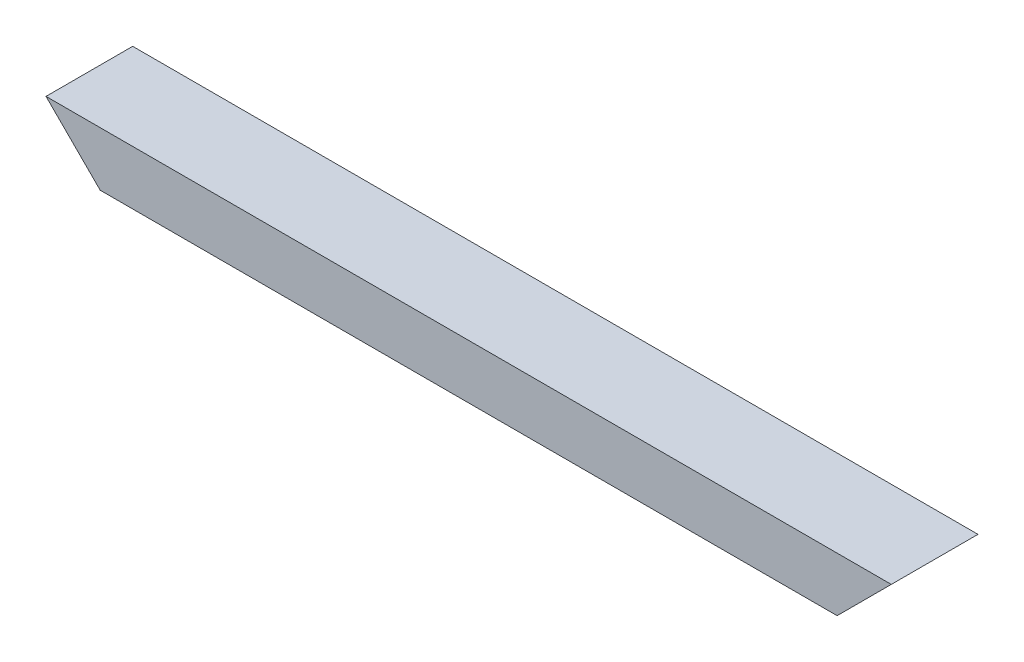
from build123d import *

# Parameters (mm, degrees)
BOSS_EXTRUDE1_DEPTH = 101.6


with BuildPart() as part:
    # Sketch2 → Boss-Extrude1 (new body)
    with BuildSketch(Plane.XY):
        Polygon((0, 0), (863.6, 0), (927.1, 63.5), (-63.5, 63.5), align=None)
    extrude(amount=BOSS_EXTRUDE1_DEPTH)


solid = part.part
